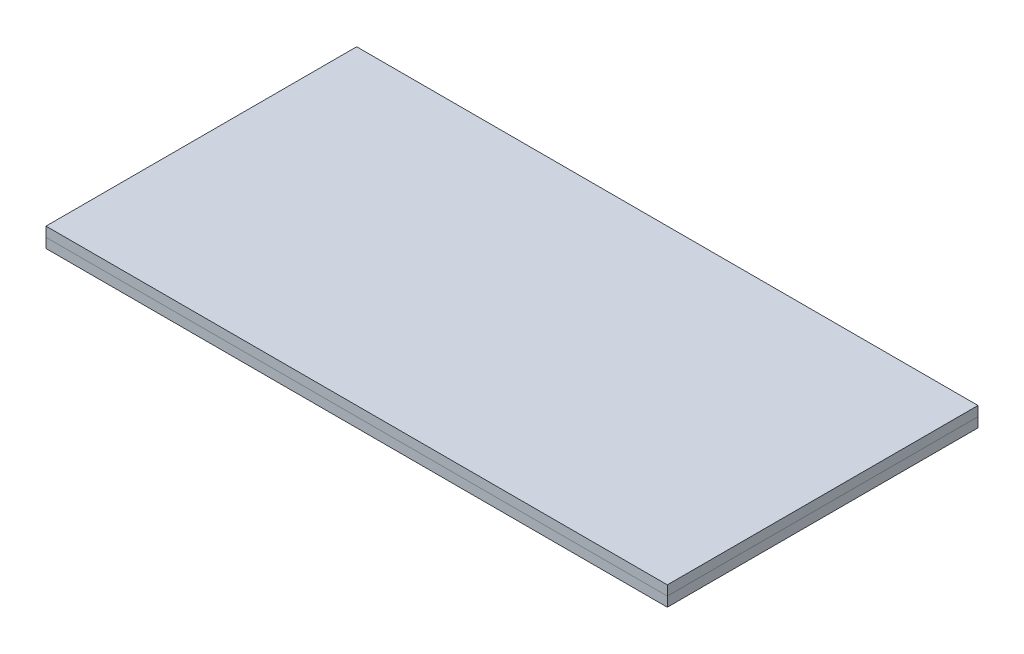
from build123d import *

# Parameters (mm, degrees)
SKETCH1_W       = 1219.2
SKETCH1_H       = 609.6
MDF_SLAB1_DEPTH = 19.05
SKETCH2_W       = 1219.2
SKETCH2_H       = 609.6
MDF_SLAB2_DEPTH = 19.05


with BuildPart() as part:
    # Sketch1 → MDF_Slab1 (new body)
    with BuildSketch(Plane(origin=(0, 0, 0), x_dir=(1, 0, 0), z_dir=(0, 1, 0))):
        Rectangle(SKETCH1_W, SKETCH1_H)
    extrude(amount=MDF_SLAB1_DEPTH)


with BuildPart() as body_2:
    # Sketch2 → MDF_Slab2 (new body)
    with BuildSketch(Plane(origin=(0, 19.05, 0), x_dir=(1, 0, 0), z_dir=(0, 1, 0))):
        Rectangle(SKETCH2_W, SKETCH2_H)
    extrude(amount=MDF_SLAB2_DEPTH)


solid = Compound([part.part, body_2.part])
